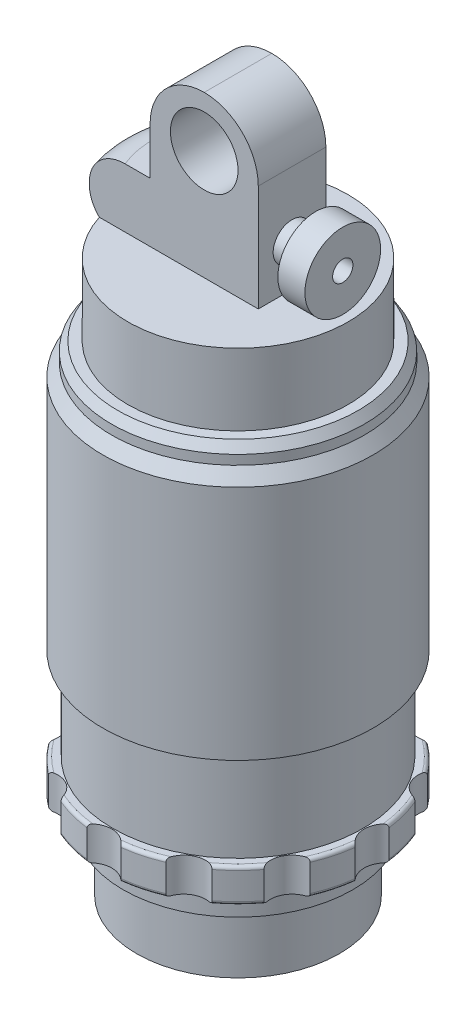
from build123d import *

# Parameters (mm, degrees)
SKETCH1_R          = 12.7
EXTRUDE1_DEPTH     = 103.632
SKETCH2_R          = 12.7
CUT_EXTRUDE1_DEPTH = 63.5
EXTRUDE2_DEPTH     = 11.1125
SKETCH5_W          = 20.32
SKETCH5_H          = 12.7
EXTRUDE3_DEPTH     = 19.05
FILLET1_R          = 10.16
SKETCH6_R          = 6.35
CUT_EXTRUDE2_DEPTH = 140.836299759
FILLET2_R          = 6.35
SKETCH9_R          = 4.7625
EXTRUDE5_DEPTH     = 19.05
FILLET3_R          = 2.54
FILLET5_R          = 0.635
EXTRUDE7_REACH     = 118.847


# Some blends are built 0.0001 mm under size
with BuildPart() as part:
    # Sketch1 → Extrude1 (new body)
    with BuildSketch(Plane(origin=(0, 0, 0), x_dir=(1, 0, 0), z_dir=(0, 1, 0))):
        with Locations(Location((0, 0, 0), (0, 0, 270))):
            Circle(SKETCH1_R)
    extrude(amount=EXTRUDE1_DEPTH)

    # Sketch12 → Revolve1 (revolve)
    with BuildSketch(Plane.XY, mode=Mode.PRIVATE) as revolve1_sk:
        Polygon((0, 0), (-19.05, 0), (-19.05, 11.684), (-21.59, 11.684), (-21.59, 16.256), (-25.4, 16.256), (-25.4, 22.606), (-23.495, 22.606), (-23.495, 39.878), (-25.4, 39.878), (-25.4, 84.328), (-23.749, 86.729454545), (-23.749, 88.507454545), (-22.606, 90.17), (-20.701, 90.17), (-20.701, 103.632), (0, 103.632), align=None)
    revolve(revolve1_sk.sketch.rotate(Axis((0, 0, 0), (0, 1, 0)), 270), axis=Axis((0, 0, 0), (0, 1, 0)))

    # Sketch2 → Cut-Extrude1 (cut)
    with BuildSketch(Plane.XZ):
        with Locations(Location((0, 0, 0), (0, 0, 270))):
            Circle(SKETCH2_R)
    extrude(amount=-CUT_EXTRUDE1_DEPTH, mode=Mode.SUBTRACT)

    # Sketch3 → Extrude2 (add)
    with BuildSketch(Plane(origin=(0, 103.632, 0), x_dir=(-1, 0, 0), z_dir=(0, 1, 0))):
        with BuildLine():
            Line((-10.16, -6.35), (21.59, -6.35))
            ThreePointArc((21.59, -6.35), (22.504457336, 0), (21.59, 6.35))
            Line((21.59, 6.35), (-10.16, 6.35))
            Line((-10.16, 6.35), (-10.16, -6.35))
        make_face()
    extrude(amount=EXTRUDE2_DEPTH)

    # Sketch5 → Extrude3 (add)
    with BuildSketch(Plane(origin=(0, 114.7445, 0), x_dir=(-1, 0, 0), z_dir=(0, 1, 0))):
        Rectangle(SKETCH5_W, SKETCH5_H)
    extrude(amount=EXTRUDE3_DEPTH)

    # Fillet1
    fillet1_edges = [part.edges().sort_by_distance(p)[0] for p in [
        (-10.16, 133.7945, 0),
        (10.16, 133.7945, 0),
    ]]
    fillet(fillet1_edges, radius=FILLET1_R - 0.0001)  # a hair under: the kernel refuses the full size

    # Sketch6 → Cut-Extrude2 (cut, through all)
    with BuildSketch(Plane.XY.offset(6.35)):
        with Locations((0, 124.2695)):
            Circle(SKETCH6_R)
    extrude(amount=-CUT_EXTRUDE2_DEPTH, mode=Mode.SUBTRACT)

    # Sketch13 → Revolve2 (revolve)
    with BuildSketch(Plane.XY, mode=Mode.PRIVATE) as revolve2_sk:
        Polygon((10.16, 114.9858), (10.16, 111.4298), (13.335, 111.4298), (13.335, 113.3348), (19.685, 113.3348), (19.685, 118.5418), (14.605, 118.5418), (14.605, 114.9858), align=None)
    revolve(revolve2_sk.sketch.rotate(Axis((3.588576262, 111.4298, 0), (1, 0, 0)), 90), axis=Axis((3.588576262, 111.4298, 0), (1, 0, 0)))

    # Fillet2
    # the kernel refuses this fillet: 6.35 mm, written as the material it takes off along each edge
    with BuildSketch(Plane(origin=(0, 114.7445, 0), x_dir=(-0.5474311612846685, 0, -0.836850717663861), z_dir=(0.836850717663861, 0, -0.5474311612846685))) as fillet2_piece_1:
        with BuildLine():
            CenterArc((22.504457336 - FILLET2_R, -FILLET2_R), FILLET2_R, 0, 90)
            Line((22.504457336 - FILLET2_R, 0), (22.504457336 - FILLET2_R, FILLET2_R * 0.02))
            Line((22.504457336 - FILLET2_R, FILLET2_R * 0.02), (22.504457336 + FILLET2_R * 0.02, FILLET2_R * 0.02))
            Line((22.504457336 + FILLET2_R * 0.02, FILLET2_R * 0.02), (22.504457336 + FILLET2_R * 0.02, -FILLET2_R))
            Line((22.504457336 + FILLET2_R * 0.02, -FILLET2_R), (22.504457336, -FILLET2_R))
        make_face()
    revolve(axis=Axis((0, 114.7445, 0), (0, 1, 0)), revolution_arc=113.618084463, mode=Mode.SUBTRACT)
    with BuildSketch(Plane(origin=(0, 103.632, 0), x_dir=(-0.7119429502905001, 0, -0.7022373071346028), z_dir=(0.7022373071346028, 0, -0.7119429502905001))) as fillet2_piece_2:
        with BuildLine():
            CenterArc((16.154457336, 4.432995579), FILLET2_R, 315.724471773, 44.275528227)
            Line((22.504457336, 4.432995579), (22.631457336, 4.432995579))
            Line((22.631457336, 4.432995579), (22.631457336, 0))
            Line((22.631457336, 0), (22.504457336, -0.127))
            ThreePointArc((22.504457336, -0.127), (21.602728668, -0.127), (20.791930853, -0.088659912))
            Line((20.791930853, -0.088659912), (20.701, 0))
        make_face()
    revolve(axis=Axis((0, 103.632, 0), (0, 1, 0)), revolution_arc=89.213560426, mode=Mode.SUBTRACT)

    # Sketch9 → Extrude5 (add)
    with BuildSketch(Plane(origin=(0, 0, -6.35), x_dir=(-1, 0, 0), z_dir=(0, 0, -1))):
        with Locations(Location((15.24, 109.4105, 0), (0, 0, 180))):
            Circle(SKETCH9_R)
    extrude(amount=EXTRUDE5_DEPTH)

    # Fillet3
    fillet3_edges = [part.edges().sort_by_distance(p)[0] for p in [
        (-20.0025, 109.4105, -25.4),
    ]]
    fillet(fillet3_edges, radius=FILLET3_R)

    # Fillet5
    fillet5_edges = [part.edges().sort_by_distance(p)[0] for p in [
        (0, 11.684, 19.05),
        (0, 16.256, 25.4),
        (0, 22.606, 25.4),
    ]]
    fillet(fillet5_edges, radius=FILLET5_R)

    # Extrude7: up to this face of the body (flat: up to its plane)
    extrude7_end = Plane(part.part.faces().sort_by_distance((0, 16.256, 24.064540023))[0])
    # Sketch14 → Extrude7 (cut, up to the picked face)
    with BuildSketch(Plane(origin=(0, 22.606, 0), x_dir=(1, 0, 0), z_dir=(0, 1, 0)), mode=Mode.PRIVATE) as extrude7_sk1:
        with BuildLine():
            ThreePointArc((-20.237016747, 15.350021276), (-21.997045256, 12.7), (-23.412016747, 9.850759962))
            ThreePointArc((-23.412016747, 9.850759962), (-20.512244701, 11.84275), (-20.237016747, 15.350021276))
        make_face()
    extrude7_tool1 = split(extrude(extrude7_sk1.sketch, amount=-EXTRUDE7_REACH, mode=Mode.PRIVATE), bisect_by=extrude7_end, keep=Keep.BOTH, mode=Mode.PRIVATE)
    # Sketch14 → Extrude7 (cut, up to the picked face)
    with BuildSketch(Plane(origin=(0, 22.606, 0), x_dir=(1, 0, 0), z_dir=(0, 1, 0)), mode=Mode.PRIVATE) as extrude7_sk2:
        with BuildLine():
            ThreePointArc((-25.200781238, 3.175), (-25.4, 0), (-25.200781238, -3.175))
            ThreePointArc((-25.200781238, -3.175), (-23.6855, 0), (-25.200781238, 3.175))
        make_face()
    extrude7_tool2 = split(extrude(extrude7_sk2.sketch, amount=-EXTRUDE7_REACH, mode=Mode.PRIVATE), bisect_by=extrude7_end, keep=Keep.BOTH, mode=Mode.PRIVATE)
    # Sketch14 → Extrude7 (cut, up to the picked face)
    with BuildSketch(Plane(origin=(0, 22.606, 0), x_dir=(1, 0, 0), z_dir=(0, 1, 0)), mode=Mode.PRIVATE) as extrude7_sk3:
        with BuildLine():
            ThreePointArc((-9.850759962, 23.412016747), (-12.7, 21.997045256), (-15.350021276, 20.237016747))
            ThreePointArc((-15.350021276, 20.237016747), (-11.84275, 20.512244701), (-9.850759962, 23.412016747))
        make_face()
    extrude7_tool3 = split(extrude(extrude7_sk3.sketch, amount=-EXTRUDE7_REACH, mode=Mode.PRIVATE), bisect_by=extrude7_end, keep=Keep.BOTH, mode=Mode.PRIVATE)
    # Sketch14 → Extrude7 (cut, up to the picked face)
    with BuildSketch(Plane(origin=(0, 22.606, 0), x_dir=(1, 0, 0), z_dir=(0, 1, 0)), mode=Mode.PRIVATE) as extrude7_sk4:
        with BuildLine():
            ThreePointArc((3.175, 25.200781238), (0, 25.4), (-3.175, 25.200781238))
            ThreePointArc((-3.175, 25.200781238), (0, 23.6855), (3.175, 25.200781238))
        make_face()
    extrude7_tool4 = split(extrude(extrude7_sk4.sketch, amount=-EXTRUDE7_REACH, mode=Mode.PRIVATE), bisect_by=extrude7_end, keep=Keep.BOTH, mode=Mode.PRIVATE)
    # Sketch14 → Extrude7 (cut, up to the picked face)
    with BuildSketch(Plane(origin=(0, 22.606, 0), x_dir=(1, 0, 0), z_dir=(0, 1, 0)), mode=Mode.PRIVATE) as extrude7_sk5:
        with BuildLine():
            ThreePointArc((15.350021276, 20.237016747), (12.7, 21.997045256), (9.850759962, 23.412016747))
            ThreePointArc((9.850759962, 23.412016747), (11.84275, 20.512244701), (15.350021276, 20.237016747))
        make_face()
    extrude7_tool5 = split(extrude(extrude7_sk5.sketch, amount=-EXTRUDE7_REACH, mode=Mode.PRIVATE), bisect_by=extrude7_end, keep=Keep.BOTH, mode=Mode.PRIVATE)
    # Sketch14 → Extrude7 (cut, up to the picked face)
    with BuildSketch(Plane(origin=(0, 22.606, 0), x_dir=(1, 0, 0), z_dir=(0, 1, 0)), mode=Mode.PRIVATE) as extrude7_sk6:
        with BuildLine():
            ThreePointArc((23.412016747, 9.850759962), (21.997045256, 12.7), (20.237016747, 15.350021276))
            ThreePointArc((20.237016747, 15.350021276), (20.512244701, 11.84275), (23.412016747, 9.850759962))
        make_face()
    extrude7_tool6 = split(extrude(extrude7_sk6.sketch, amount=-EXTRUDE7_REACH, mode=Mode.PRIVATE), bisect_by=extrude7_end, keep=Keep.BOTH, mode=Mode.PRIVATE)
    # Sketch14 → Extrude7 (cut, up to the picked face)
    with BuildSketch(Plane(origin=(0, 22.606, 0), x_dir=(1, 0, 0), z_dir=(0, 1, 0)), mode=Mode.PRIVATE) as extrude7_sk7:
        with BuildLine():
            ThreePointArc((25.200781238, -3.175), (25.4, 0), (25.200781238, 3.175))
            ThreePointArc((25.200781238, 3.175), (23.6855, 0), (25.200781238, -3.175))
        make_face()
    extrude7_tool7 = split(extrude(extrude7_sk7.sketch, amount=-EXTRUDE7_REACH, mode=Mode.PRIVATE), bisect_by=extrude7_end, keep=Keep.BOTH, mode=Mode.PRIVATE)
    # Sketch14 → Extrude7 (cut, up to the picked face)
    with BuildSketch(Plane(origin=(0, 22.606, 0), x_dir=(1, 0, 0), z_dir=(0, 1, 0)), mode=Mode.PRIVATE) as extrude7_sk8:
        with BuildLine():
            ThreePointArc((20.237016747, -15.350021276), (21.997045256, -12.7), (23.412016747, -9.850759962))
            ThreePointArc((23.412016747, -9.850759962), (20.512244701, -11.84275), (20.237016747, -15.350021276))
        make_face()
    extrude7_tool8 = split(extrude(extrude7_sk8.sketch, amount=-EXTRUDE7_REACH, mode=Mode.PRIVATE), bisect_by=extrude7_end, keep=Keep.BOTH, mode=Mode.PRIVATE)
    # Sketch14 → Extrude7 (cut, up to the picked face)
    with BuildSketch(Plane(origin=(0, 22.606, 0), x_dir=(1, 0, 0), z_dir=(0, 1, 0)), mode=Mode.PRIVATE) as extrude7_sk9:
        with BuildLine():
            ThreePointArc((9.850759962, -23.412016747), (12.7, -21.997045256), (15.350021276, -20.237016747))
            ThreePointArc((15.350021276, -20.237016747), (11.84275, -20.512244701), (9.850759962, -23.412016747))
        make_face()
    extrude7_tool9 = split(extrude(extrude7_sk9.sketch, amount=-EXTRUDE7_REACH, mode=Mode.PRIVATE), bisect_by=extrude7_end, keep=Keep.BOTH, mode=Mode.PRIVATE)
    # Sketch14 → Extrude7 (cut, up to the picked face)
    with BuildSketch(Plane(origin=(0, 22.606, 0), x_dir=(1, 0, 0), z_dir=(0, 1, 0)), mode=Mode.PRIVATE) as extrude7_sk10:
        with BuildLine():
            ThreePointArc((-3.175, -25.200781238), (0, -25.4), (3.175, -25.200781238))
            ThreePointArc((3.175, -25.200781238), (0, -23.6855), (-3.175, -25.200781238))
        make_face()
    extrude7_tool10 = split(extrude(extrude7_sk10.sketch, amount=-EXTRUDE7_REACH, mode=Mode.PRIVATE), bisect_by=extrude7_end, keep=Keep.BOTH, mode=Mode.PRIVATE)
    # Sketch14 → Extrude7 (cut, up to the picked face)
    with BuildSketch(Plane(origin=(0, 22.606, 0), x_dir=(1, 0, 0), z_dir=(0, 1, 0)), mode=Mode.PRIVATE) as extrude7_sk11:
        with BuildLine():
            ThreePointArc((-15.350021276, -20.237016747), (-12.7, -21.997045256), (-9.850759962, -23.412016747))
            ThreePointArc((-9.850759962, -23.412016747), (-11.84275, -20.512244701), (-15.350021276, -20.237016747))
        make_face()
    extrude7_tool11 = split(extrude(extrude7_sk11.sketch, amount=-EXTRUDE7_REACH, mode=Mode.PRIVATE), bisect_by=extrude7_end, keep=Keep.BOTH, mode=Mode.PRIVATE)
    # Sketch14 → Extrude7 (cut, up to the picked face)
    with BuildSketch(Plane(origin=(0, 22.606, 0), x_dir=(1, 0, 0), z_dir=(0, 1, 0)), mode=Mode.PRIVATE) as extrude7_sk12:
        with BuildLine():
            ThreePointArc((-23.412016747, -9.850759962), (-21.997045256, -12.7), (-20.237016747, -15.350021276))
            ThreePointArc((-20.237016747, -15.350021276), (-20.512244701, -11.84275), (-23.412016747, -9.850759962))
        make_face()
    extrude7_tool12 = split(extrude(extrude7_sk12.sketch, amount=-EXTRUDE7_REACH, mode=Mode.PRIVATE), bisect_by=extrude7_end, keep=Keep.BOTH, mode=Mode.PRIVATE)
    add(extrude7_tool1.solids().sort_by(Axis((-21.357764, 22.606, -12.330911), (0, -1, 0)))[0], mode=Mode.SUBTRACT)
    add(extrude7_tool2.solids().sort_by(Axis((-24.661821, 22.606, 0), (0, -1, 0)))[0], mode=Mode.SUBTRACT)
    add(extrude7_tool3.solids().sort_by(Axis((-12.330911, 22.606, -21.357764), (0, -1, 0)))[0], mode=Mode.SUBTRACT)
    add(extrude7_tool4.solids().sort_by(Axis((0, 22.606, -24.661821), (0, -1, 0)))[0], mode=Mode.SUBTRACT)
    add(extrude7_tool5.solids().sort_by(Axis((12.330911, 22.606, -21.357764), (0, -1, 0)))[0], mode=Mode.SUBTRACT)
    add(extrude7_tool6.solids().sort_by(Axis((21.357764, 22.606, -12.330911), (0, -1, 0)))[0], mode=Mode.SUBTRACT)
    add(extrude7_tool7.solids().sort_by(Axis((24.661821, 22.606, 0), (0, -1, 0)))[0], mode=Mode.SUBTRACT)
    add(extrude7_tool8.solids().sort_by(Axis((21.357764, 22.606, 12.330911), (0, -1, 0)))[0], mode=Mode.SUBTRACT)
    add(extrude7_tool9.solids().sort_by(Axis((12.330911, 22.606, 21.357764), (0, -1, 0)))[0], mode=Mode.SUBTRACT)
    add(extrude7_tool10.solids().sort_by(Axis((0, 22.606, 24.661821), (0, -1, 0)))[0], mode=Mode.SUBTRACT)
    add(extrude7_tool11.solids().sort_by(Axis((-12.330911, 22.606, 21.357764), (0, -1, 0)))[0], mode=Mode.SUBTRACT)
    add(extrude7_tool12.solids().sort_by(Axis((-21.357764, 22.606, 12.330911), (0, -1, 0)))[0], mode=Mode.SUBTRACT)


solid = part.part
